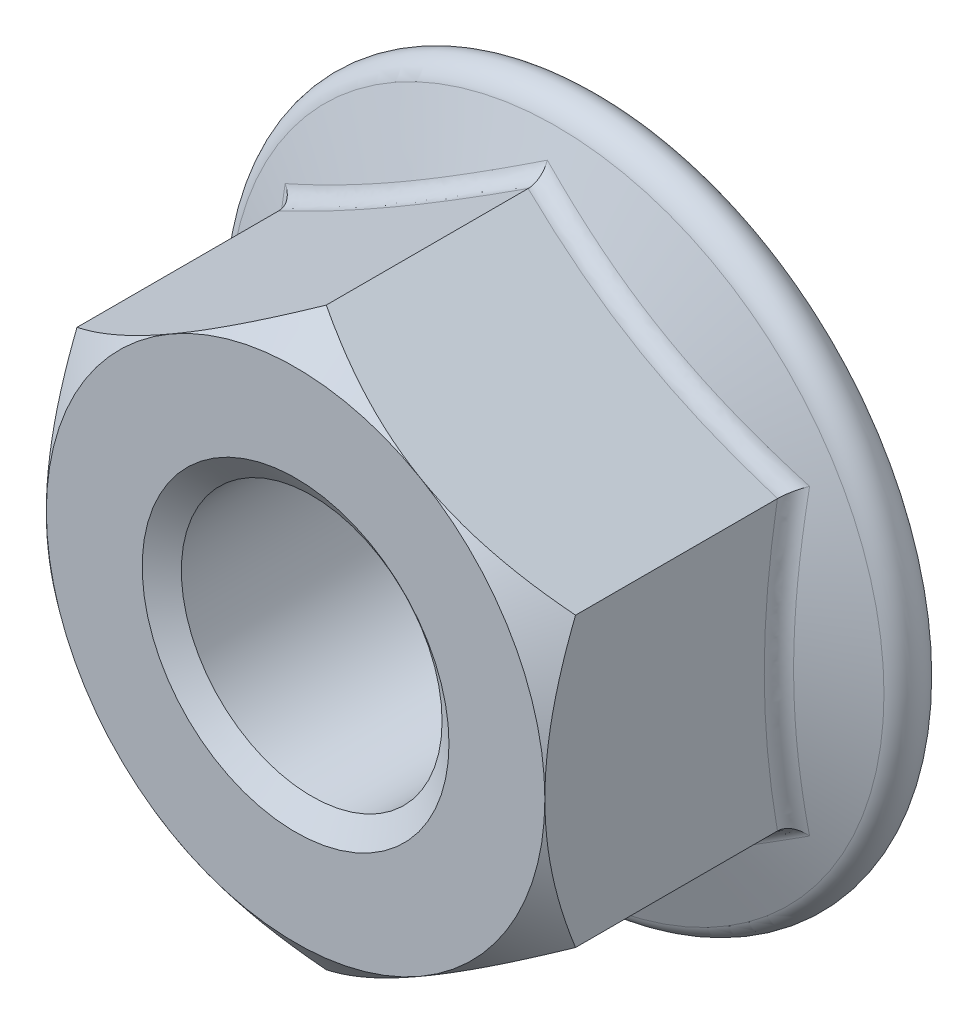
from build123d import *

# Parameters (mm, degrees)
BASENUT_START  = -8
BASENUTSKE_R   = 3.4
BASENUT_DEPTH  = 8
FLANGEFILLET_R = 0.48


# Read off the part's stored shape, not the designer's step: ThreadSchematic
with BuildPart() as part:
    # BaseNutSke → BaseNut (new body)
    with BuildSketch(Plane.XY.offset(BASENUT_START)):
        Polygon((6.5, 3.75277675), (6.5, -3.75277675), (0, -7.505553499), (-6.5, -3.75277675), (-6.5, 3.75277675), (0, 7.505553499), align=None)
        Circle(BASENUTSKE_R, mode=Mode.SUBTRACT)
    extrude(amount=BASENUT_DEPTH)

    # Sketch5 (on Right Plane) → EndChamfer (revolve, cut)
    with BuildSketch(Plane(origin=(0, 0, 0), x_dir=(0, 0, -1), z_dir=(1, 0, 0))):
        Polygon((7.9746, 4), (7.512463025, 3.34), (8.0254, 3.34), (8.0254, 4), align=None)
    revolve(axis=Axis((0, 3.34, -8.0254), (0, 0, 1)), mode=Mode.SUBTRACT)

    # Sketch6 → Flange (revolve)
    with BuildSketch(Plane(origin=(0, 0, 0), x_dir=(0, 0, -1), z_dir=(1, 0, 0)), mode=Mode.PRIVATE) as flange_sk:
        with BuildLine():
            Line((4.928123777, 3.4), (6.8, 8.542937654))
            ThreePointArc((6.8, 8.542937654), (7.488773543, 8.940601245), (8, 8.331345278))
            Line((8, 8.331345278), (8, 3.4))
            Line((8, 3.4), (4.928123777, 3.4))
        make_face()
    revolve(flange_sk.sketch.rotate(Axis((0, 0, 0), (0, 0, -1)), 90), axis=Axis((0, 0, 0), (0, 0, -1)))

    # Sketch3 → Double-Chamfer (revolve, cut)
    with BuildSketch(Plane(origin=(0, 0, 0), x_dir=(0, 0, -1), z_dir=(1, 0, 0)), mode=Mode.PRIVATE) as double_chamfer_sk:
        Polygon((0.8, 20.205553499), (-12.7, 20.205553499), (-12.7, 6.5), (0, 6.5), (0.8, 7.505553499), align=None)
    revolve(double_chamfer_sk.sketch.rotate(Axis((0, 0, 0), (0, 0, -1)), 90), axis=Axis((0, 0, 0), (0, 0, -1)), mode=Mode.SUBTRACT)

    # FlangeFillet
    flangefillet_edges = [part.edges().sort_by_distance(p)[0] for p in [
        (6.5, 1.884573791, -6.153862438),
        (3.25, 5.629165125, -6.056431503),
        (-3.25, 5.629165125, -6.056431503),
        (-6.5, 0, -6.056431503),
        (-3.25, -5.629165125, -6.056431503),
        (3.25, -5.629165125, -6.056431503),
        (6.5, -1.884573791, -6.153862438),
    ]]
    fillet(flangefillet_edges, radius=FLANGEFILLET_R)

    # ThreadSchematic outline → ThreadSchematic (revolve, cut)
    with BuildSketch(Plane.XZ):
        Polygon((3.4, 0), (3.4, -0.420124523), (4, 0), align=None)
        Polygon((4, -7.9746), (3.4, -7.554475477), (3.4, -8), (4, -8), align=None)
    revolve(axis=Axis((0, 0, 0), (0, 0, 1)), mode=Mode.SUBTRACT)


solid = part.part
